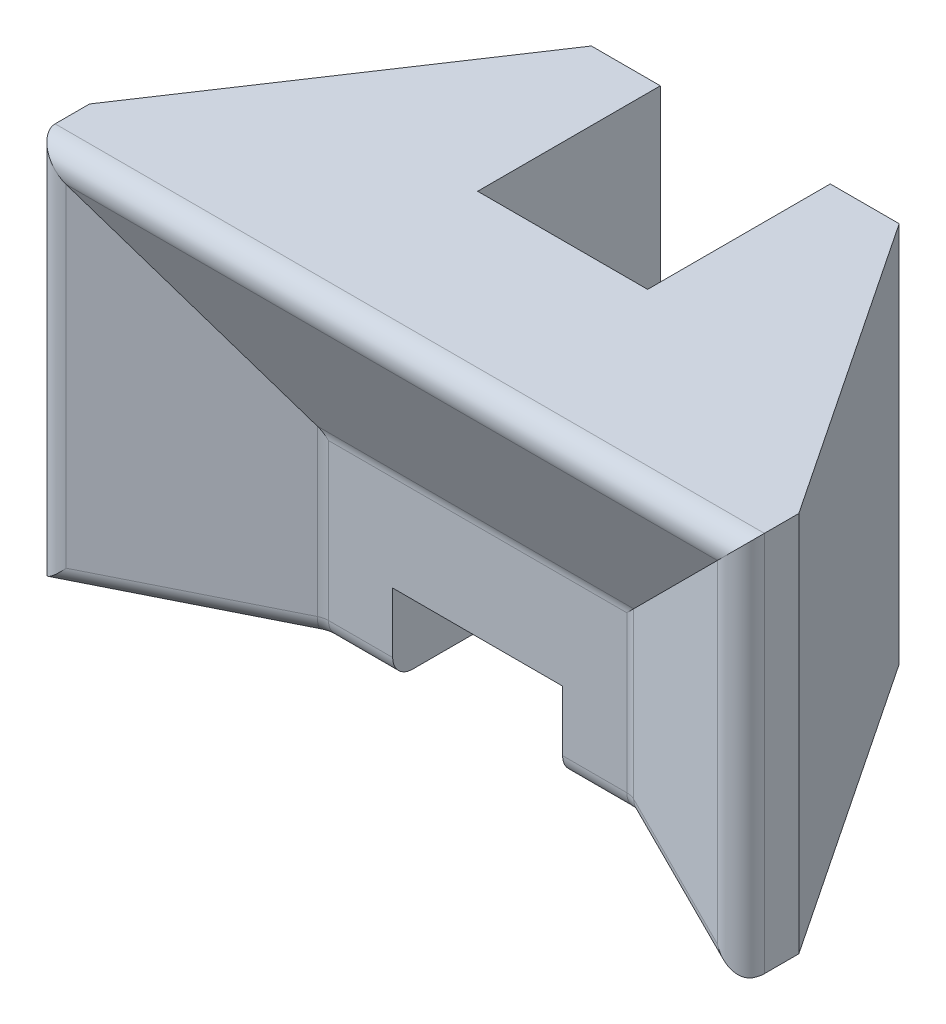
from build123d import *
from OCP.BRepFilletAPI import BRepFilletAPI_MakeChamfer

# Parameters (mm, degrees)
BOSS_EXTRUDE1_DEPTH = 15
SKETCH4_W           = 106
SKETCH4_H           = 57
BOSS_EXTRUDE3_DEPTH = 40
SKETCH5_W           = 25.4
SKETCH5_H           = 12.7
CUT_EXTRUDE3_DEPTH  = 12
SKETCH5_3_W         = 25.4
SKETCH5_3_H         = 27.3
CUT_EXTRUDE4_DEPTH  = 88.509999429
CHAMFER3_SIZE       = 45
CHAMFER3_SIZE2      = 30
FILLET2_R           = 3


with BuildPart() as part:
    # Sketch1 → Boss-Extrude1 (new body)
    with BuildSketch(Plane.XY):
        Polygon((23, -13.5), (53, -13.5), (53, 43.5), (-53, 43.5), (-53, -13.5), (-23, -13.5), (-23, 13.5), (23, 13.5), align=None)
    extrude(amount=BOSS_EXTRUDE1_DEPTH)

    # Chamfer1
    # the kernel refuses this chamfer: 30, 15 mm, written as the material it takes off along each edge
    with BuildSketch(Plane(origin=(23, 13.5, 15), x_dir=(-0.06891834360170887, 0, -0.9976223042390325), z_dir=(0, -1, 0)), Plane(origin=(-23, -13.5, 15), x_dir=(0.06891834360170887, 0, -0.9976223042390325), z_dir=(0, 1, 0))) as chamfer1_piece_1:
        with BuildLine():
            Line((15.573685801, 0), (-2.676901546, 30.962444281))
            Line((-2.676901546, 30.962444281), (-3.275474928, 30.921093275))
            ThreePointArc((-3.275474928, 30.921093275), (-1.669334001, 15.458363867), (-0.598573383, -0.041351006))
            Line((-0.598573383, -0.041351006), (0.041351006, -0.598573383))
            ThreePointArc((0.041351006, -0.598573383), (7.791208443, -0.063193073), (15.615036807, -0.598573383))
            Line((15.615036807, -0.598573383), (15.573685801, 0))
        make_face()
    extrude(amount=27, mode=Mode.SUBTRACT)
    with BuildSketch(Plane(origin=(-23, 13.5, 15), x_dir=(0, -0.06891834360170876, -0.9976223042390325), z_dir=(1, 0, 0))) as chamfer1_piece_2:
        with BuildLine():
            Line((15.573685801, 0), (-2.676901546, 30.962444281))
            Line((-2.676901546, 30.962444281), (-3.275474928, 30.921093275))
            ThreePointArc((-3.275474928, 30.921093275), (-1.669334001, 15.458363867), (-0.598573383, -0.041351006))
            Line((-0.598573383, -0.041351006), (0.041351006, -0.598573383))
            ThreePointArc((0.041351006, -0.598573383), (7.791208443, -0.063193073), (15.615036807, -0.598573383))
            Line((15.615036807, -0.598573383), (15.573685801, 0))
        make_face()
    extrude(amount=46, mode=Mode.SUBTRACT)
    with BuildSketch(Plane(origin=(-23, 13.5, 15), x_dir=(0, -0.06891834360170876, -0.9976223042390325), z_dir=(1, 0, 0))) as chamfer1_piece_3a_section:
        with BuildLine():
            Line((15.573685801, 0), (-2.676901546, 30.962444281))
            Line((-2.676901546, 30.962444281), (-3.275474928, 30.921093275))
            ThreePointArc((-3.275474928, 30.921093275), (-1.669334001, 15.458363867), (-0.598573383, -0.041351006))
            Line((-0.598573383, -0.041351006), (0.041351006, -0.598573383))
            ThreePointArc((0.041351006, -0.598573383), (7.791208443, -0.063193073), (15.615036807, -0.598573383))
            Line((15.615036807, -0.598573383), (15.573685801, 0))
        make_face()
    chamfer1_piece_3a = extrude(amount=123.694866214, mode=Mode.PRIVATE)
    chamfer1_piece_3a = split(chamfer1_piece_3a, bisect_by=Plane(origin=(23, 23.617605247, 10.241766787), z_dir=(1, 0, 0)), keep=Keep.TOP, mode=Mode.PRIVATE)
    with BuildSketch(Plane(origin=(23, 91.194866214, 15), x_dir=(-0.06891834360170887, 0, -0.9976223042390325), z_dir=(0, -1, 0))) as chamfer1_piece_3b_section:
        with BuildLine():
            Line((15.573685801, 0), (-2.676901546, 30.962444281))
            Line((-2.676901546, 30.962444281), (-3.275474928, 30.921093275))
            ThreePointArc((-3.275474928, 30.921093275), (-1.669334001, 15.458363867), (-0.598573383, -0.041351006))
            Line((-0.598573383, -0.041351006), (0.041351006, -0.598573383))
            ThreePointArc((0.041351006, -0.598573383), (7.791208443, -0.063193073), (15.615036807, -0.598573383))
            Line((15.615036807, -0.598573383), (15.573685801, 0))
        make_face()
    chamfer1_piece_3b = extrude(amount=104.694866214, mode=Mode.PRIVATE)
    chamfer1_piece_3b = split(chamfer1_piece_3b, bisect_by=Plane(origin=(33.117605247, 13.5, 10.241766787), z_dir=(0, 1, 0)), keep=Keep.TOP, mode=Mode.PRIVATE)
    chamfer1_piece_3 = chamfer1_piece_3a & chamfer1_piece_3b
    add(chamfer1_piece_3, mode=Mode.SUBTRACT)
    with BuildSketch(Plane(origin=(-23, -13.5, 15), x_dir=(0.06891834360170887, 0, -0.9976223042390325), z_dir=(0, 1, 0))) as chamfer1_piece_4a_section:
        with BuildLine():
            Line((15.573685801, 0), (-2.676901546, 30.962444281))
            Line((-2.676901546, 30.962444281), (-3.275474928, 30.921093275))
            ThreePointArc((-3.275474928, 30.921093275), (-1.669334001, 15.458363867), (-0.598573383, -0.041351006))
            Line((-0.598573383, -0.041351006), (0.041351006, -0.598573383))
            ThreePointArc((0.041351006, -0.598573383), (7.791208443, -0.063193073), (15.615036807, -0.598573383))
            Line((15.615036807, -0.598573383), (15.573685801, 0))
        make_face()
    chamfer1_piece_4a = extrude(amount=104.694866214, mode=Mode.PRIVATE)
    chamfer1_piece_4a = split(chamfer1_piece_4a, bisect_by=Plane(origin=(-33.117605247, 13.5, 10.241766787), z_dir=(0, 1, 0)), keep=Keep.TOP, mode=Mode.PRIVATE)
    with BuildSketch(Plane(origin=(-100.694866214, 13.5, 15), x_dir=(0, -0.06891834360170876, -0.9976223042390325), z_dir=(1, 0, 0))) as chamfer1_piece_4b_section:
        with BuildLine():
            Line((15.573685801, 0), (-2.676901546, 30.962444281))
            Line((-2.676901546, 30.962444281), (-3.275474928, 30.921093275))
            ThreePointArc((-3.275474928, 30.921093275), (-1.669334001, 15.458363867), (-0.598573383, -0.041351006))
            Line((-0.598573383, -0.041351006), (0.041351006, -0.598573383))
            ThreePointArc((0.041351006, -0.598573383), (7.791208443, -0.063193073), (15.615036807, -0.598573383))
            Line((15.615036807, -0.598573383), (15.573685801, 0))
        make_face()
    chamfer1_piece_4b = extrude(amount=123.694866214, mode=Mode.PRIVATE)
    chamfer1_piece_4b = split(chamfer1_piece_4b, bisect_by=Plane(origin=(-23, 23.617605247, 10.241766787), z_dir=(-1, 0, 0)), keep=Keep.TOP, mode=Mode.PRIVATE)
    chamfer1_piece_4 = chamfer1_piece_4a & chamfer1_piece_4b
    add(chamfer1_piece_4, mode=Mode.SUBTRACT)

    # Sketch4 → Boss-Extrude3 (add)
    with BuildSketch(Plane(origin=(0, 0, 0), x_dir=(-1, 0, 0), z_dir=(0, 0, -1))):
        with Locations((0, 15)):
            Rectangle(SKETCH4_W, SKETCH4_H)
    extrude(amount=BOSS_EXTRUDE3_DEPTH)

    # Sketch5 → Cut-Extrude3 (cut)
    with BuildSketch(Plane.XZ.offset(13.5)):
        with Locations((0, -6.35)):
            Rectangle(SKETCH5_W, SKETCH5_H)
    extrude(amount=-CUT_EXTRUDE3_DEPTH, mode=Mode.SUBTRACT)

    # Sketch5<3> → Cut-Extrude4 (cut, through all)
    with BuildSketch(Plane.XZ.offset(13.5)):
        with Locations((0, -26.35)):
            Rectangle(SKETCH5_3_W, SKETCH5_3_H)
    extrude(amount=-CUT_EXTRUDE4_DEPTH, mode=Mode.SUBTRACT)

    # Chamfer3: one chamfer whose edges measure the first distance from different faces: ONE call of the kernel's chamfer builder (chamfer() names one face for all edges)
    chamfer3_edges_1 = [part.edges().sort_by_distance(p)[0] for p in [
        (53, 15, -40),
    ]]
    chamfer3_side_1 = [part.faces().sort_by_distance(p)[0] for p in [
        (53, 15, -12.5),
    ]]
    chamfer3_edges_2 = [part.edges().sort_by_distance(p)[0] for p in [
        (-53, 15, -40),
    ]]
    chamfer3_side_2 = [part.faces().sort_by_distance(p)[0] for p in [
        (-53, 15, -12.5),
    ]]
    chamfer3 = BRepFilletAPI_MakeChamfer(part.part.solid().wrapped)
    for e in chamfer3_edges_1:
        chamfer3.Add(CHAMFER3_SIZE, CHAMFER3_SIZE2, e.wrapped, chamfer3_side_1[0].wrapped)  # the first distance lies on this face
    for e in chamfer3_edges_2:
        chamfer3.Add(CHAMFER3_SIZE, CHAMFER3_SIZE2, e.wrapped, chamfer3_side_2[0].wrapped)  # the first distance lies on this face
    add(Compound.cast(chamfer3.Shape()), mode=Mode.REPLACE)

    # Fillet2
    fillet2_edges = [part.edges().sort_by_distance(p)[0] for p in [
        (23, 0, 0),
        (0, 13.5, 0),
        (-23, 0, 0),
    ]]
    fillet(fillet2_edges, radius=FILLET2_R)
    fillet2_2_edges = [part.edges().sort_by_distance(p)[0] for p in [
        (53, 15, 15),
        (0, 43.5, 15),
        (-53, 15, 15),
        (38.316718427, -13.5, 7.658359213),
        (-38.316718427, -13.5, 7.658359213),
        (17.495898034, -13.5, 0),
        (-17.495898034, -13.5, 0),
        (-22.981054829, -13.5, 0.080253032),
        (22.981054829, -13.5, 0.080253032),
    ]]
    fillet(fillet2_2_edges, radius=FILLET2_R)


solid = part.part
